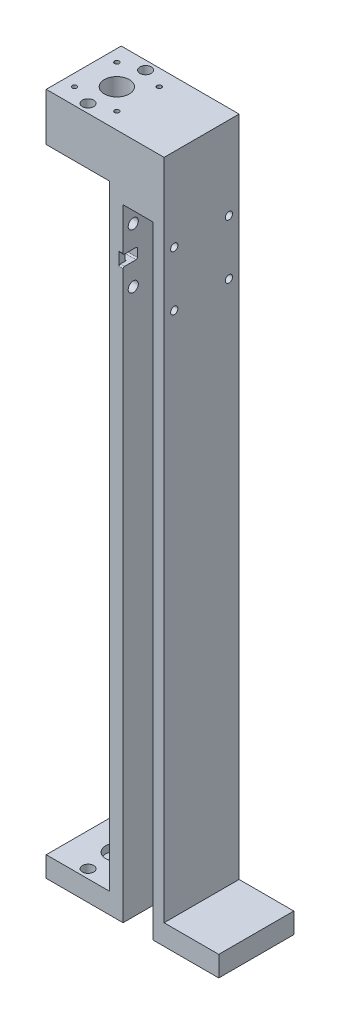
from build123d import *
from OCP.BRepAlgoAPI import BRepAlgoAPI_Cut
from OCP.TopTools import TopTools_ListOfShape

# Parameters (mm, degrees)
SKETCH1_W           = 56.24
SKETCH1_H           = 54.9
SKETCH1_R           = 4.15
BOSS_EXTRUDE1_DEPTH = 500
SKETCH3_W           = 54.9
SKETCH3_H           = 450
CUT_EXTRUDE1_DEPTH  = 46.24
SKETCH6_R           = 9.15
SKETCH6_R_2         = 1.65
CUT_EXTRUDE2_DEPTH  = 46.24
SKETCH8_R           = 4.15
CUT_EXTRUDE4_DEPTH  = 40
SKETCH8_6_R         = 8.15
SKETCH8_6_R_2       = 4.15
CUT_EXTRUDE5_DEPTH  = 5.2
SKETCH10_W          = 54.9
SKETCH10_H          = 45
BOSS_EXTRUDE2_DEPTH = 22
SKETCH11_W          = 8
SKETCH11_H          = 54.900000346
BOSS_EXTRUDE3_DEPTH = 500
SKETCH12_R          = 3.7
CUT_EXTRUDE7_DEPTH  = 20
SKETCH12_4_R        = 6
SKETCH12_4_R_2      = 3.7
CUT_EXTRUDE8_DEPTH  = 4.8
SKETCH13_W          = 54.900000346
SKETCH13_H          = 15
BOSS_EXTRUDE4_DEPTH = 40
SKETCH14_R          = 5
CUT_EXTRUDE9_DEPTH  = 25
SKETCH15_R          = 2.65
CUT_EXTRUDE10_DEPTH = 24.5
CUT_EXTRUDE11_DEPTH = 15
CUT_EXTRUDE14_DEPTH = 3


with BuildPart() as part:
    # Sketch1 → Boss-Extrude1 (new body)
    with BuildSketch(Plane(origin=(0, 0, 0), x_dir=(1, 0, 0), z_dir=(0, 1, 0))):
        Rectangle(SKETCH1_W, SKETCH1_H)
        with Locations((-3.905000488, -21.045000488)):
            Circle(SKETCH1_R, mode=Mode.SUBTRACT)
        with Locations((-3.905000488, 21.044999843)):
            Circle(SKETCH1_R, mode=Mode.SUBTRACT)
    extrude(amount=BOSS_EXTRUDE1_DEPTH)

    # Sketch3 → Cut-Extrude1 (cut)
    with BuildSketch(Plane.ZY.offset(28.12)):
        with Locations((0, 240)):
            Rectangle(SKETCH3_W, SKETCH3_H)
    extrude(amount=-CUT_EXTRUDE1_DEPTH, mode=Mode.SUBTRACT)

    # Sketch6 → Cut-Extrude2 (cut)
    with BuildSketch(Plane(origin=(0, 500, 0), x_dir=(1, 0, 0), z_dir=(0, 1, 0))):
        with Locations((-3.905000488, -3.23e-07)):
            Circle(SKETCH6_R)
        with Locations((-19.405000488, 15.5)):
            Circle(SKETCH6_R_2)
        with Locations((11.594999512, 15.5)):
            Circle(SKETCH6_R_2)
        with Locations((11.594999512, -15.5)):
            Circle(SKETCH6_R_2)
        with Locations((-19.405000488, -15.5)):
            Circle(SKETCH6_R_2)
    extrude(amount=-CUT_EXTRUDE2_DEPTH, mode=Mode.SUBTRACT)

    # Sketch8 → Cut-Extrude4 (cut)
    with BuildSketch(Plane(origin=(0, 15, 0), x_dir=(1, 0, 0), z_dir=(0, 1, 0))):
        with Locations((-3.905000488, -3.23e-07)):
            Circle(SKETCH8_R)
    extrude(amount=-CUT_EXTRUDE4_DEPTH, mode=Mode.SUBTRACT)

    # Sketch8<6> → Cut-Extrude5 (cut)
    with BuildSketch(Plane(origin=(0, 15, 0), x_dir=(1, 0, 0), z_dir=(0, 1, 0))):
        with Locations((-3.905000488, -3.23e-07)):
            Circle(SKETCH8_6_R)
        with Locations((-3.905000488, -3.23e-07)):
            Circle(SKETCH8_6_R_2, mode=Mode.SUBTRACT)
    extrude(amount=-CUT_EXTRUDE5_DEPTH, mode=Mode.SUBTRACT)

    # Sketch10 → Boss-Extrude2 (add)
    with BuildSketch(Plane(origin=(28.12, 0, 0), x_dir=(0, 0, -1), z_dir=(1, 0, 0))):
        with Locations((0, 477.5)):
            Rectangle(SKETCH10_W, SKETCH10_H)
    extrude(amount=BOSS_EXTRUDE2_DEPTH)

    # Sketch11 → Boss-Extrude3 (add)
    with BuildSketch(Plane(origin=(0, 500, 0), x_dir=(1, 0, 0), z_dir=(0, 1, 0))):
        with Locations((54.12, -1.73e-07)):
            Rectangle(SKETCH11_W, SKETCH11_H)
    extrude(amount=-BOSS_EXTRUDE3_DEPTH)

    # Sketch12 → Cut-Extrude7 (cut)
    with BuildSketch(Plane.ZY.offset(-18.12)):
        with Locations((-20, 439.3)):
            Circle(SKETCH12_R)
        with Locations((20, 439.3)):
            Circle(SKETCH12_R)
        with Locations((20, 399.3)):
            Circle(SKETCH12_R)
        with Locations((-20, 399.3)):
            Circle(SKETCH12_R)
    extrude(amount=-CUT_EXTRUDE7_DEPTH, mode=Mode.SUBTRACT)

    # Sketch12<4> → Cut-Extrude8 (cut)
    # profile 1 of 4: a face of its own
    with BuildSketch(Plane.ZY.offset(-18.12)):
        with Locations((-20, 439.3)):
            Circle(SKETCH12_4_R)
        with Locations((-20, 439.3)):
            Circle(SKETCH12_4_R_2, mode=Mode.SUBTRACT)
    # profile 2 of 4: a face of its own
    with BuildSketch(Plane.ZY.offset(-18.12)):
        with Locations((20, 439.3)):
            Circle(SKETCH12_4_R)
        with Locations((20, 439.3)):
            Circle(SKETCH12_4_R_2, mode=Mode.SUBTRACT)
    # profile 3 of 4: a face of its own
    with BuildSketch(Plane.ZY.offset(-18.12)):
        with Locations((20, 399.3)):
            Circle(SKETCH12_4_R)
        with Locations((20, 399.3)):
            Circle(SKETCH12_4_R_2, mode=Mode.SUBTRACT)
    # profile 4 of 4: a face of its own
    with BuildSketch(Plane.ZY.offset(-18.12)):
        with Locations((-20, 399.3)):
            Circle(SKETCH12_4_R)
        with Locations((-20, 399.3)):
            Circle(SKETCH12_4_R_2, mode=Mode.SUBTRACT)
    extrude(amount=-CUT_EXTRUDE8_DEPTH, mode=Mode.SUBTRACT)

    # Sketch13 → Boss-Extrude4 (add)
    with BuildSketch(Plane(origin=(58.12, 0, 0), x_dir=(0, 0, -1), z_dir=(1, 0, 0))):
        with Locations((-1.73e-07, 7.5)):
            Rectangle(SKETCH13_W, SKETCH13_H)
    extrude(amount=BOSS_EXTRUDE4_DEPTH)

    # Sketch14 → Cut-Extrude9 (cut)
    with BuildSketch(Plane.XZ.offset(-465)):
        with Locations((-19.405000488, 15.5)):
            Circle(SKETCH14_R)
        with Locations((11.594999512, 15.5)):
            Circle(SKETCH14_R)
        with Locations((11.594999512, -15.526899995)):
            Circle(SKETCH14_R)
        with Locations((-19.405000488, -15.526899995)):
            Circle(SKETCH14_R)
    extrude(amount=-CUT_EXTRUDE9_DEPTH, mode=Mode.SUBTRACT)

    # Sketch15 → Cut-Extrude10 (cut)
    with BuildSketch(Plane.ZY.offset(-50.12)):
        with Locations((-20, 439.3)):
            Circle(SKETCH15_R)
        with Locations((20, 439.3)):
            Circle(SKETCH15_R)
        with Locations((20, 399.3)):
            Circle(SKETCH15_R)
        with Locations((-20, 399.3)):
            Circle(SKETCH15_R)
    extrude(amount=-CUT_EXTRUDE10_DEPTH, mode=Mode.SUBTRACT)

    # Sketch16 → Cut-Extrude11 (cut)
    with BuildSketch(Plane.ZY.offset(-18.12)):
        with BuildLine():
            ThreePointArc((22, 415.4), (22.707106781, 415.692893219), (23, 416.4))
            Line((23, 416.4), (23, 422.2))
            ThreePointArc((23, 422.2), (22.707106781, 422.907106781), (22, 423.2))
            Line((22, 423.2), (18, 423.2))
            ThreePointArc((18, 423.2), (17.292893219, 422.907106781), (17, 422.2))
            Line((17, 422.2), (17, 416.4))
            ThreePointArc((17, 416.4), (17.292893219, 415.692893219), (18, 415.4))
            Line((18, 415.4), (22, 415.4))
        make_face()
        with BuildLine():
            ThreePointArc((-23, 416.4), (-22.707106781, 415.692893219), (-22, 415.4))
            Line((-22, 415.4), (-18, 415.4))
            ThreePointArc((-18, 415.4), (-17.292893219, 415.692893219), (-17, 416.4))
            Line((-17, 416.4), (-17, 422.2))
            ThreePointArc((-17, 422.2), (-17.292893219, 422.907106781), (-18, 423.2))
            Line((-18, 423.2), (-22, 423.2))
            ThreePointArc((-22, 423.2), (-22.707106781, 422.907106781), (-23, 422.2))
            Line((-23, 422.2), (-23, 416.4))
        make_face()
    extrude(amount=-CUT_EXTRUDE11_DEPTH, mode=Mode.SUBTRACT)


with BuildPart() as cut_extrude14_tool:
    # Sketch18 → Cut-Extrude14 (new body)
    with BuildSketch(Plane(origin=(28.12, 0, 0), x_dir=(0, 0, -1), z_dir=(1, 0, 0))):
        with BuildLine():
            Line((26.449999654, 423.2), (22, 423.2))
            Line((22, 423.2), (22, 415.4))
            Line((22, 415.4), (26.449999654, 415.4))
            ThreePointArc((26.449999654, 415.4), (27.157106435, 415.107106781), (27.449999654, 414.4))
            Line((27.449999654, 414.4), (27.449999654, 424.2))
            ThreePointArc((27.449999654, 424.2), (27.157106435, 423.492893219), (26.449999654, 423.2))
        make_face()
        with BuildLine():
            Line((-27.449999654, 424.2), (-27.449999654, 414.4))
            ThreePointArc((-27.449999654, 414.4), (-27.157106435, 415.107106781), (-26.449999654, 415.4))
            Line((-26.449999654, 415.4), (-22, 415.4))
            Line((-22, 415.4), (-22, 423.2))
            Line((-22, 423.2), (-26.449999654, 423.2))
            ThreePointArc((-26.449999654, 423.2), (-27.157106435, 423.492893219), (-27.449999654, 424.2))
        make_face()
    extrude(amount=-CUT_EXTRUDE14_DEPTH)


with BuildPart() as part_1:
    add(part.part)

    # Cut-Extrude14: cut by cut_extrude14_tool, with a tolerance
    cut_extrude14_stock = TopTools_ListOfShape()
    cut_extrude14_stock.Append(part_1.part.wrapped)
    cut_extrude14_tools = TopTools_ListOfShape()
    cut_extrude14_tools.Append(cut_extrude14_tool.part.wrapped)
    cut_extrude14_cut = BRepAlgoAPI_Cut()
    cut_extrude14_cut.SetArguments(cut_extrude14_stock)
    cut_extrude14_cut.SetTools(cut_extrude14_tools)
    cut_extrude14_cut.SetFuzzyValue(0.00001)
    cut_extrude14_cut.Build()
    add(Compound.cast(cut_extrude14_cut.Shape()).solids(), mode=Mode.REPLACE)


solid = part_1.part
